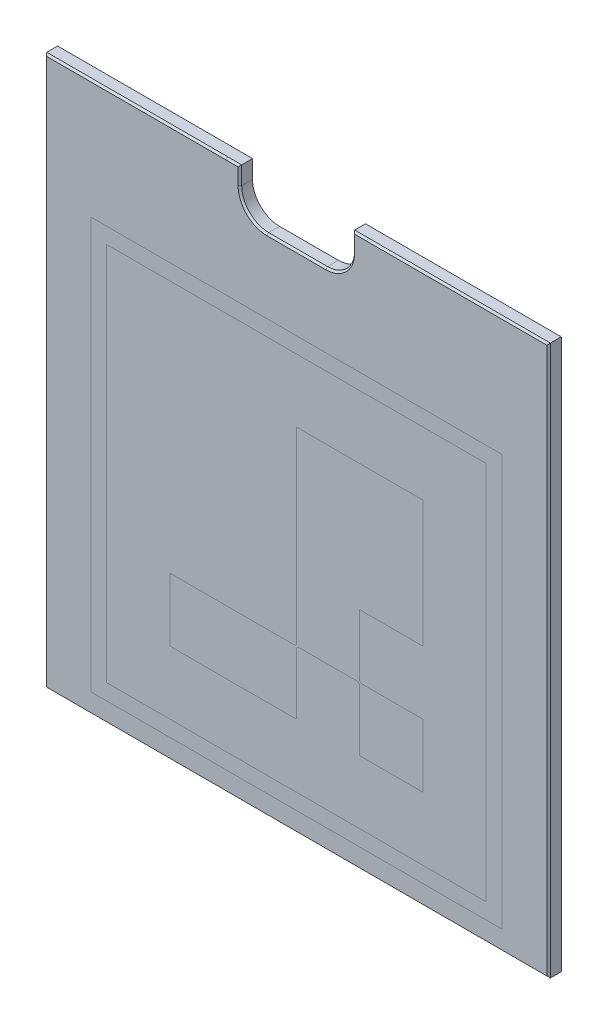
from build123d import *
from build123d.topology import SkipClean

# Parameters (mm, degrees)
SKETCH1_R           = 1.35
BOSS_EXTRUDE1_DEPTH = 2.8
SKETCH3_R           = 2.5
CUT_EXTRUDE1_DEPTH  = 2.2
SKETCH4_W           = 91.3
SKETCH4_H           = 85.4
CUT_EXTRUDE2_DEPTH  = 1.5
CUT_EXTRUDE3_DEPTH  = 0.2
SKETCH6_W           = 2.7
SKETCH6_H           = 2.7
CUT_EXTRUDE4_DEPTH  = 0.2
CHAMFER1_SIZE       = 0.4
SKETCH7_W           = 91
SKETCH7_H           = 91
CUT_EXTRUDE5_DEPTH  = 0.4
SKETCH8_W           = 91
SKETCH8_H           = 91
SKETCH8_W_2         = 84
SKETCH8_H_2         = 84
BOSS_EXTRUDE2_DEPTH = 0.4
CUT_EXTRUDE6_DEPTH  = 0.4
BOSS_EXTRUDE3_DEPTH = 0.4
BOSS_EXTRUDE4_START = -2.8
SKETCH11_W          = 31.175
SKETCH11_H          = 25.7
BOSS_EXTRUDE4_DEPTH = 2.8
CHAMFER2_SIZE       = 0.4
SKETCH12_R          = 2.5
BOSS_EXTRUDE5_DEPTH = 2.8
SKETCH13_R          = 3.2
CUT_EXTRUDE7_DEPTH  = 1.2
SKETCH14_W          = 25
SKETCH14_H          = 10
CUT_EXTRUDE8_DEPTH  = 88.754163007
FILLET1_R           = 6
CHAMFER3_SIZE       = 0.4


with BuildPart() as part:
    # Sketch1 → Boss-Extrude1 (new body)
    with BuildSketch(Plane.XY):
        Polygon((-15.25, 54.05), (-15.25, 28.75), (15.125, 28.75), (15.125, 54.05), (55.825, 54.05), (55.825, -67.65), (-55.65, -67.65), (-55.65, 54.05), align=None)
        with Locations((-52, 50)):
            Circle(SKETCH1_R, mode=Mode.SUBTRACT)
        with Locations((-52, 2.9)):
            Circle(SKETCH1_R, mode=Mode.SUBTRACT)
        with Locations((-52, -64)):
            Circle(SKETCH1_R, mode=Mode.SUBTRACT)
        with Locations((52, 50)):
            Circle(SKETCH1_R, mode=Mode.SUBTRACT)
        with Locations((52, 2.9)):
            Circle(SKETCH1_R, mode=Mode.SUBTRACT)
        with Locations((52, -64)):
            Circle(SKETCH1_R, mode=Mode.SUBTRACT)
    extrude(amount=BOSS_EXTRUDE1_DEPTH)

    # Sketch3 → Cut-Extrude1 (cut)
    with BuildSketch(Plane.XY.offset(2.8)):
        with Locations((-52, 50)):
            Circle(SKETCH3_R)
        with Locations((-52, 2.9)):
            Circle(SKETCH3_R)
        with Locations((-52, -64)):
            Circle(SKETCH3_R)
        with Locations((52, -64)):
            Circle(SKETCH3_R)
        with Locations((52, 2.9)):
            Circle(SKETCH3_R)
        with Locations((52, 50)):
            Circle(SKETCH3_R)
    extrude(amount=-CUT_EXTRUDE1_DEPTH, mode=Mode.SUBTRACT)

    # Sketch4 → Cut-Extrude2 (cut)
    with BuildSketch(Plane(origin=(0, 0, 0), x_dir=(-1, 0, 0), z_dir=(0, 0, -1))):
        with Locations((0, -14.95)):
            Rectangle(SKETCH4_W, SKETCH4_H)
    extrude(amount=-CUT_EXTRUDE2_DEPTH, mode=Mode.SUBTRACT)

    # Sketch5 → Cut-Extrude3 (cut)
    with SkipClean():  # the faces are left unmerged after this step: merging them gives an invalid solid
        with BuildSketch(Plane.XY.offset(0.6)):
            with BuildLine():
                Line((-53.35, 47.895837459), (-53.35, 52.104162541))
                ThreePointArc((-53.35, 52.104162541), (-52, 52.5), (-50.65, 52.104162541))
                Line((-50.65, 52.104162541), (-50.65, 47.895837459))
                ThreePointArc((-50.65, 47.895837459), (-52, 47.5), (-53.35, 47.895837459))
            make_face()
            with BuildLine():
                Line((-53.35, 0.795837459), (-53.35, 5.004162541))
                ThreePointArc((-53.35, 5.004162541), (-52, 5.4), (-50.65, 5.004162541))
                Line((-50.65, 5.004162541), (-50.65, 0.795837459))
                ThreePointArc((-50.65, 0.795837459), (-52, 0.4), (-53.35, 0.795837459))
            make_face()
            with BuildLine():
                Line((-53.35, -66.104162541), (-53.35, -61.895837459))
                ThreePointArc((-53.35, -61.895837459), (-52, -61.5), (-50.65, -61.895837459))
                Line((-50.65, -61.895837459), (-50.65, -66.104162541))
                ThreePointArc((-50.65, -66.104162541), (-52, -66.5), (-53.35, -66.104162541))
            make_face()
        cut_extrude3 = extrude(amount=-CUT_EXTRUDE3_DEPTH, mode=Mode.SUBTRACT)

    # Sketch6 → Cut-Extrude4 (cut)
    with SkipClean():  # the faces are left unmerged after this step: merging them gives an invalid solid
        with BuildSketch(Plane.XY.offset(0.4)):
            with Locations((-52, -64)):
                Rectangle(SKETCH6_W, SKETCH6_H)
            with Locations((-52, 2.9)):
                Rectangle(SKETCH6_W, SKETCH6_H)
            with Locations((-52, 50)):
                Rectangle(SKETCH6_W, SKETCH6_H)
        cut_extrude4 = extrude(amount=-CUT_EXTRUDE4_DEPTH, mode=Mode.SUBTRACT)

    # Mirror1: Cut-Extrude3, Cut-Extrude4 across plane
    with SkipClean():  # the faces are left unmerged after this step: merging them gives an invalid solid
        add(cut_extrude3.mirror(Plane(origin=(0, 0, 0), x_dir=(0, 0, 1), z_dir=(1, 0, 0))), mode=Mode.SUBTRACT)
        add(cut_extrude4.mirror(Plane(origin=(0, 0, 0), x_dir=(0, 0, 1), z_dir=(1, 0, 0))), mode=Mode.SUBTRACT)

    # Chamfer1
    chamfer1_edges = [part.edges().sort_by_distance(p)[0] for p in [
        (55.825, -6.8, 2.8),
        (35.475, 54.05, 2.8),
        (15.125, 41.4, 2.8),
        (-0.0625, 28.75, 2.8),
        (-15.25, 41.4, 2.8),
        (-35.45, 54.05, 2.8),
        (-55.65, -6.8, 2.8),
        (0.0875, -67.65, 2.8),
    ]]
    chamfer(chamfer1_edges, length=CHAMFER1_SIZE)

    # Sketch7 → Cut-Extrude5 (cut)
    with SkipClean():  # the faces are left unmerged after this step: merging them gives an invalid solid
        with BuildSketch(Plane.XY.offset(2.8)):
            with Locations((0, -17.75)):
                Rectangle(SKETCH7_W, SKETCH7_H)
            Polygon((28, 24.25), (42, 24.25), (42, 10.25), (42, -3.75), (42, -17.75), (42, -31.75), (42, -45.75), (42, -59.75), (28, -59.75), (14, -59.75), (0, -59.75), (-14, -59.75), (-28, -59.75), (-42, -59.75), (-42, -45.75), (-42, -31.75), (-42, -17.75), (-42, -3.75), (-42, 10.25), (-42, 24.25), (-28, 24.25), (-14, 24.25), (0, 24.25), (14, 24.25), align=None, mode=Mode.SUBTRACT)
        extrude(amount=-CUT_EXTRUDE5_DEPTH, mode=Mode.SUBTRACT)

    # Sketch9 → Cut-Extrude6 (cut)
    with SkipClean():  # the faces are left unmerged after this step: merging them gives an invalid solid
        with BuildSketch(Plane.XY.offset(2.8)):
            Polygon((-28, -31.75), (-28, -45.75), (-14, -45.75), (0, -45.75), (0, -32.103553391), (0.353553391, -31.75), (13.646446609, -31.75), (14, -32.103553391), (14, -45.75), (28, -45.75), (28, -31.75), (14.353553391, -31.75), (14, -31.396446609), (14, -17.75), (28, -17.75), (28, -3.75), (28, 10.25), (14, 10.25), (0, 10.25), (0, -3.75), (0, -17.75), (0, -31.396446609), (-0.353553391, -31.75), (-14, -31.75), align=None)
        extrude(amount=-CUT_EXTRUDE6_DEPTH, mode=Mode.SUBTRACT)

    # Sketch11 → Boss-Extrude4 (add)
    with SkipClean():  # the faces are left unmerged after this step: merging them gives an invalid solid
        with BuildSketch(Plane.XY.offset(2.8).offset(BOSS_EXTRUDE4_START)):
            with Locations((-0.0625, 41.2)):
                Rectangle(SKETCH11_W, SKETCH11_H)
        extrude(amount=BOSS_EXTRUDE4_DEPTH)

    # Chamfer2
    chamfer2_edges = [part.edges().sort_by_distance(p)[0] for p in [
        (-0.0625, 54.05, 2.8),
    ]]
    chamfer(chamfer2_edges, length=CHAMFER2_SIZE - 0.0001)  # a hair under: the kernel refuses the full size

    # Sketch12 → Boss-Extrude5 (add)
    with BuildSketch(Plane.XY.offset(2.8)):
        with Locations((52, -64)):
            Circle(SKETCH12_R)
        with Locations((52, 50)):
            Circle(SKETCH12_R)
        with Locations((52, 2.9)):
            Circle(SKETCH12_R)
        with Locations((-52, -64)):
            Circle(SKETCH12_R)
        with Locations((-52, 2.9)):
            Circle(SKETCH12_R)
        with Locations((-52, 50)):
            Circle(SKETCH12_R)
    extrude(amount=-BOSS_EXTRUDE5_DEPTH)

    # Sketch13 → Cut-Extrude7 (cut)
    with BuildSketch(Plane(origin=(0, 0, 0), x_dir=(-1, 0, 0), z_dir=(0, 0, -1))):
        with Locations((-50.825, 49.05)):
            Circle(SKETCH13_R)
        with Locations((50.825, 49.05)):
            Circle(SKETCH13_R)
        with Locations((50.825, -62.65)):
            Circle(SKETCH13_R)
        with Locations((-50.825, -62.65)):
            Circle(SKETCH13_R)
        with Locations((-50.825, -6.8)):
            Circle(SKETCH13_R)
        with Locations((50.825, -6.8)):
            Circle(SKETCH13_R)
    extrude(amount=-CUT_EXTRUDE7_DEPTH, mode=Mode.SUBTRACT)

    # Sketch14 → Cut-Extrude8 (cut, through all)
    with BuildSketch(Plane.XY.offset(2.8)):
        with Locations((0, 49.05)):
            Rectangle(SKETCH14_W, SKETCH14_H)
    extrude(amount=-CUT_EXTRUDE8_DEPTH, mode=Mode.SUBTRACT)

    # Fillet1
    fillet1_edges = [part.edges().sort_by_distance(p)[0] for p in [
        (-12.5, 44.05, 1.4),
        (12.5, 44.05, 1.4),
    ]]
    fillet(fillet1_edges, radius=FILLET1_R)

    # Chamfer3
    chamfer3_edges = [part.edges().sort_by_distance(p)[0] for p in [
        (-12.5, 51.85005, 2.8),
        (12.5, 51.85005, 2.8),
        (0, 44.05, 2.8),
        (10.742640687, 45.807359313, 2.8),
        (-10.742640687, 45.807359313, 2.8),
    ]]
    chamfer(chamfer3_edges, length=CHAMFER3_SIZE)


with BuildPart() as body_2:
    # Sketch8 → Boss-Extrude2 (new body)
    with BuildSketch(Plane.XY.offset(2.4)):
        with Locations((0, -17.75)):
            Rectangle(SKETCH8_W, SKETCH8_H)
        with Locations((0, -17.75)):
            Rectangle(SKETCH8_W_2, SKETCH8_H_2, mode=Mode.SUBTRACT)
    extrude(amount=BOSS_EXTRUDE2_DEPTH)


with BuildPart() as body_3:
    # Sketch10 → Boss-Extrude3 (new body)
    with BuildSketch(Plane.XY.offset(2.4)):
        Polygon((28, -31.75), (14.353553391, -31.75), (14, -31.396446609), (14, -17.75), (28, -17.75), (28, 10.25), (0, 10.25), (0, -31.396446609), (-0.353553391, -31.75), (-28, -31.75), (-28, -45.75), (0, -45.75), (0, -32.103553391), (0.353553391, -31.75), (13.646446609, -31.75), (14, -32.103553391), (14, -45.75), (28, -45.75), align=None)
    extrude(amount=BOSS_EXTRUDE3_DEPTH)


solid = Compound([part.part, body_2.part, body_3.part])
